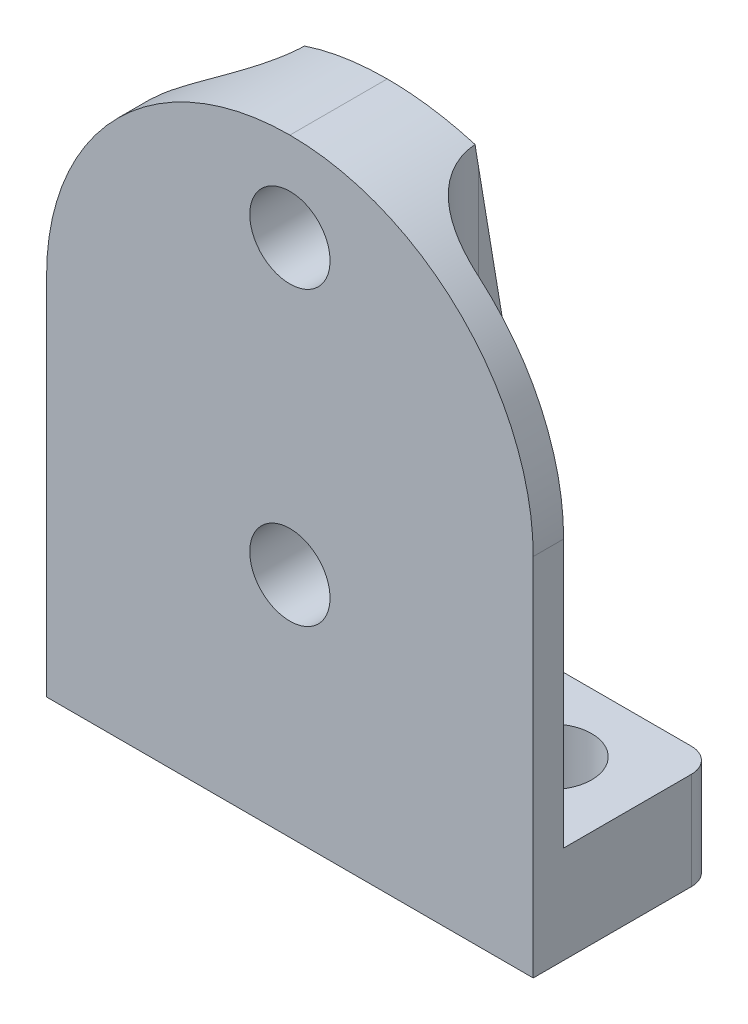
from build123d import *

# Parameters (mm, degrees)
EXTRUDE_1_DEPTH                 = 20
SKETCH_2_R                      = 1.65
CUT_EXTRUDE_1_DEPTH             = 4
CUT_EXTRUDE_1_DIRECTION_2_REACH = 31.954
CUT_EXTRUDE_START               = -21
SKETCH_3_R                      = 3
CUT_EXTRUDE_2_DEPTH             = 21
SKETCH_4_R                      = 1.65
CUT_EXTRUDE_3_DEPTH             = 4
CUT_EXTRUDE_3_DIRECTION_2_REACH = 34.265
CUT_EXTRUDE_7_REACH             = 34.265
SKETCH_5_R                      = 3
CUT_EXTRUDE_8_DEPTH             = 21
FILLET_1_R                      = 10
FILLET_2_R                      = 1


with BuildPart() as part:
    # Эскиз1 → Бобышка-Вытянуть1 (new body)
    with BuildSketch(Plane(origin=(0, 0, 0), x_dir=(0, 0, -1), z_dir=(1, 0, 0))):
        Polygon((0, 0), (7.5, 0), (7.5, 4), (4, 25), (0, 25), align=None)
    extrude(amount=EXTRUDE_1_DEPTH)

    # Эскиз2 → Вырез-Вытянуть1 (cut)
    with BuildSketch(Plane(origin=(0, 4, 0), x_dir=(-1, 0, 0), z_dir=(0, -1, 0))):
        with Locations(Location((-16.5, 4.25, 0), (0, 0, 270))):
            Circle(SKETCH_2_R)
        with Locations(Location((-3.5, 4.25, 0), (0, 0, 270))):
            Circle(SKETCH_2_R)
    extrude(amount=CUT_EXTRUDE_1_DEPTH, mode=Mode.SUBTRACT)

    # Вырез-Вытянуть1 direction 2: up to this plane
    cut_extrude_1_direction_2_end = Plane(origin=(20, 25, -4), z_dir=(0, -0.16439898730535726, 0.9863939238321437))
    # Эскиз2 → Вырез-Вытянуть1 direction 2 (cut, up to the surface)
    with BuildSketch(Plane(origin=(0, 4, 0), x_dir=(-1, 0, 0), z_dir=(0, -1, 0)), mode=Mode.PRIVATE) as cut_extrude_1_direction_2_sk1:
        with Locations(Location((-16.5, 4.25, 0), (0, 0, 270))):
            Circle(SKETCH_2_R)
    cut_extrude_1_direction_2_tool1 = split(extrude(cut_extrude_1_direction_2_sk1.sketch, amount=-CUT_EXTRUDE_1_DIRECTION_2_REACH, mode=Mode.PRIVATE), bisect_by=cut_extrude_1_direction_2_end, keep=Keep.BOTH, mode=Mode.PRIVATE)
    add(cut_extrude_1_direction_2_tool1.solids().sort_by_distance((16.5, 4, -4.25))[0], mode=Mode.SUBTRACT)
    # Эскиз2 → Вырез-Вытянуть1 direction 2 (cut, up to the surface)
    with BuildSketch(Plane(origin=(0, 4, 0), x_dir=(-1, 0, 0), z_dir=(0, -1, 0)), mode=Mode.PRIVATE) as cut_extrude_1_direction_2_sk2:
        with Locations(Location((-3.5, 4.25, 0), (0, 0, 270))):
            Circle(SKETCH_2_R)
    cut_extrude_1_direction_2_tool2 = split(extrude(cut_extrude_1_direction_2_sk2.sketch, amount=-CUT_EXTRUDE_1_DIRECTION_2_REACH, mode=Mode.PRIVATE), bisect_by=cut_extrude_1_direction_2_end, keep=Keep.BOTH, mode=Mode.PRIVATE)
    add(cut_extrude_1_direction_2_tool2.solids().sort_by_distance((3.5, 4, -4.25))[0], mode=Mode.SUBTRACT)

    # Эскиз3 → Вырез-Вытянуть2 (cut)
    with BuildSketch(Plane(origin=(0, 4, 0), x_dir=(-1, 0, 0), z_dir=(0, -1, 0)).offset(CUT_EXTRUDE_START)):
        with Locations(Location((-16.5, 4.25, 0), (0, 0, 90))):
            Circle(SKETCH_3_R)
        with Locations(Location((-3.5, 4.25, 0), (0, 0, 90))):
            Circle(SKETCH_3_R)
    extrude(amount=CUT_EXTRUDE_2_DEPTH, mode=Mode.SUBTRACT)

    # Эскиз4 → Вырез-Вытянуть3 (cut)
    with BuildSketch(Plane.XY.offset(-4)):
        with Locations(Location((10, 21.35, 0), (0, 0, 180))):
            Circle(SKETCH_4_R)
        with Locations(Location((10, 9.35, 0), (0, 0, 180))):
            Circle(SKETCH_4_R)
    extrude(amount=CUT_EXTRUDE_3_DEPTH, mode=Mode.SUBTRACT)

    # Вырез-Вытянуть3 direction 2: up to this plane
    cut_extrude_3_direction_2_end = Plane(origin=(20, 25, -4), z_dir=(0, -0.16439898730535726, 0.9863939238321437))
    # Эскиз4 → Вырез-Вытянуть3 direction 2 (cut, up to the surface)
    with BuildSketch(Plane.XY.offset(-4), mode=Mode.PRIVATE) as cut_extrude_3_direction_2_sk1:
        with Locations(Location((10, 21.35, 0), (0, 0, 180))):
            Circle(SKETCH_4_R)
    cut_extrude_3_direction_2_tool1 = split(extrude(cut_extrude_3_direction_2_sk1.sketch, amount=-CUT_EXTRUDE_3_DIRECTION_2_REACH, mode=Mode.PRIVATE), bisect_by=cut_extrude_3_direction_2_end, keep=Keep.BOTH, mode=Mode.PRIVATE)
    add(cut_extrude_3_direction_2_tool1.solids().sort_by_distance((10, 21.35, -4))[0], mode=Mode.SUBTRACT)
    # Эскиз4 → Вырез-Вытянуть3 direction 2 (cut, up to the surface)
    with BuildSketch(Plane.XY.offset(-4), mode=Mode.PRIVATE) as cut_extrude_3_direction_2_sk2:
        with Locations(Location((10, 9.35, 0), (0, 0, 180))):
            Circle(SKETCH_4_R)
    cut_extrude_3_direction_2_tool2 = split(extrude(cut_extrude_3_direction_2_sk2.sketch, amount=-CUT_EXTRUDE_3_DIRECTION_2_REACH, mode=Mode.PRIVATE), bisect_by=cut_extrude_3_direction_2_end, keep=Keep.BOTH, mode=Mode.PRIVATE)
    add(cut_extrude_3_direction_2_tool2.solids().sort_by_distance((10, 9.35, -4))[0], mode=Mode.SUBTRACT)

    # Вырез-Вытянуть7: up to this plane
    cut_extrude_7_end = Plane(origin=(20, 25, -4), z_dir=(0, -0.16439898730535726, 0.9863939238321437))
    # Эскиз5 → Вырез-Вытянуть7 (cut, up to the surface)
    with BuildSketch(Plane.XY.offset(-4), mode=Mode.PRIVATE) as cut_extrude_7_sk1:
        with Locations((10, 21.35)):
            Circle(SKETCH_5_R)
    cut_extrude_7_tool1 = split(extrude(cut_extrude_7_sk1.sketch, amount=-CUT_EXTRUDE_7_REACH, mode=Mode.PRIVATE), bisect_by=cut_extrude_7_end, keep=Keep.BOTH, mode=Mode.PRIVATE)
    add(cut_extrude_7_tool1.solids().sort_by_distance((10, 21.35, -4))[0], mode=Mode.SUBTRACT)
    # Эскиз5 → Вырез-Вытянуть7 (cut, up to the surface)
    with BuildSketch(Plane.XY.offset(-4), mode=Mode.PRIVATE) as cut_extrude_7_sk2:
        with Locations((10, 9.35)):
            Circle(SKETCH_5_R)
    cut_extrude_7_tool2 = split(extrude(cut_extrude_7_sk2.sketch, amount=-CUT_EXTRUDE_7_REACH, mode=Mode.PRIVATE), bisect_by=cut_extrude_7_end, keep=Keep.BOTH, mode=Mode.PRIVATE)
    add(cut_extrude_7_tool2.solids().sort_by_distance((10, 9.35, -4))[0], mode=Mode.SUBTRACT)

    # Эскиз6 → Вырез-Вытянуть8 (cut)
    with BuildSketch(Plane(origin=(0, 25, 0), x_dir=(1, 0, 0), z_dir=(0, 1, 0))):
        Polygon((0, 7.5), (0, 1.25), (3.5, 1.25), (3.5, 4.25), (6.5, 4.25), (6.5, 7.5), align=None)
        Polygon((13.5, 4.25), (16.5, 4.25), (16.5, 1.25), (20, 1.25), (20, 7.5), (13.5, 7.5), align=None)
    extrude(amount=-CUT_EXTRUDE_8_DEPTH, mode=Mode.SUBTRACT)

    # Скругление1
    fillet_1_edges = [part.edges().sort_by_distance(p)[0] for p in [
        (0, 25, -0.625),
        (20, 25, -0.625),
    ]]
    fillet(fillet_1_edges, radius=FILLET_1_R - 0.0001)  # a hair under: the kernel refuses the full size

    # Скругление2
    fillet_2_edges = [part.edges().sort_by_distance(p)[0] for p in [
        (20, 2, -7.5),
        (0, 2, -7.5),
    ]]
    fillet(fillet_2_edges, radius=FILLET_2_R)


solid = part.part
